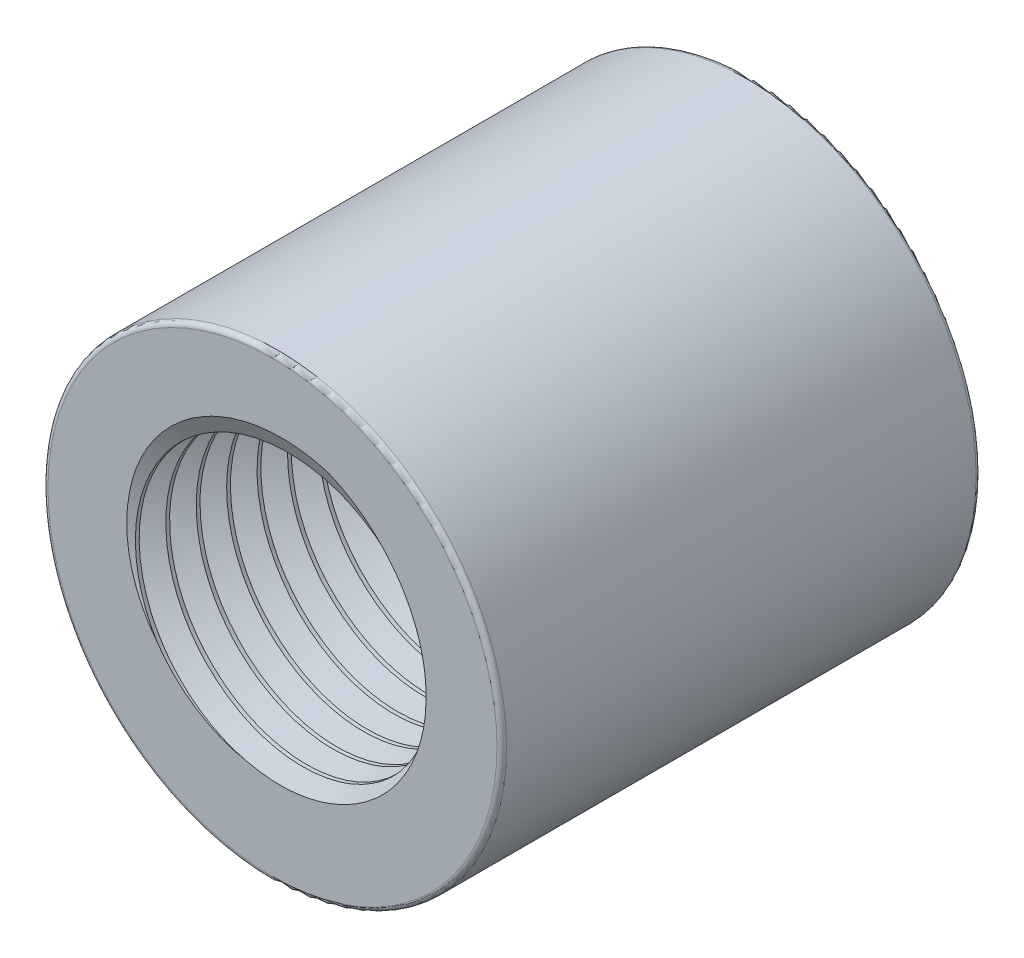
from build123d import *

# Parameters (mm, degrees)
SKETCH1_R           = 9.571872239
SKETCH1_R_2         = 5.842081884
BOSS_EXTRUDE1_DEPTH = 20
CUT_SWEEP2_PITCH    = 1.27
CUT_SWEEP3_PITCH    = 1.27
FILLET1_R           = 0.2


with BuildPart() as part:
    # Sketch1 → Boss-Extrude1 (new body)
    with BuildSketch(Plane.XY):
        with Locations((-0.518095238, -0.12952381)):
            Circle(SKETCH1_R)
        with Locations((-0.518095238, -0.12952381)):
            Circle(SKETCH1_R_2, mode=Mode.SUBTRACT)
    extrude(amount=BOSS_EXTRUDE1_DEPTH)

    # Cut-Sweep2: arcs per turn and ends read off the stored shape
    # Cut-Sweep2: the profile of Sketch3 screwed along a right-hand helix through 9 turns, 8 arcs to a turn; built about Z, then put on its axis
    cut_sweep2_z = Axis((0, 0, 0), (0, 0, 1))
    cut_sweep2_corners = [(5.477808504, -0.027220101, -0.483255868), (6.583610067, -0.006335529, -1.086883846), (5.507639332, 0.016335623, -1.742149438)]
    with BuildLine(mode=Mode.PRIVATE) as cut_sweep2_profile:
        Line(cut_sweep2_corners[0], cut_sweep2_corners[1])
        Line(cut_sweep2_corners[1], cut_sweep2_corners[2])
        Line(cut_sweep2_corners[2], cut_sweep2_corners[0])
    cut_sweep2_cap = Face(cut_sweep2_profile.wire())
    cut_sweep2_turn_angles = [0, 22.5, 45, 67.5, 90, 112.5, 135, 157.5, 180, 202.5, 225, 247.5, 270, 292.5, 315, 337.5, 360]
    cut_sweep2_turn_weights = [1, 0.9238795325112867, 1, 0.9238795325112867, 1, 0.9238795325112867, 1, 0.9238795325112867, 1, 0.9238795325112867, 1, 0.9238795325112867, 1, 0.9238795325112867, 1, 0.9238795325112867, 1]
    cut_sweep2_turn_rails = [Edge.make_bspline([Vector(p[0], p[1], 0).rotate(cut_sweep2_z, cut_sweep2_turn_angles[k]) / cut_sweep2_turn_weights[k] + Vector(0, 0, p[2] + CUT_SWEEP2_PITCH * cut_sweep2_turn_angles[k] / 360) for k in range(17)], [0, 0, 0, 1, 1, 2, 2, 3, 3, 4, 4, 5, 5, 6, 6, 7, 7, 8, 8, 8], 2, cut_sweep2_turn_weights) for p in cut_sweep2_corners]
    cut_sweep2_turn_sides = [Face.make_surface_from_curves(cut_sweep2_turn_rails[p[0]], cut_sweep2_turn_rails[p[1]]) for p in [(0, 1), (1, 2), (2, 0)]]
    cut_sweep2 = Plane(origin=(-0.518095238, -0.12952381, 0), x_dir=(0.7071067811865512, 0.7071067811865438, 0), z_dir=(0, 0, 1)) * Solid(Shell([*[p.moved(Location((0, 0, CUT_SWEEP2_PITCH * i))) for i in range(9) for p in cut_sweep2_turn_sides], cut_sweep2_cap, cut_sweep2_cap.rotate(cut_sweep2_z, 3240).moved(Location((0, 0, CUT_SWEEP2_PITCH * 3240 / 360)))]))
    add(cut_sweep2, mode=Mode.SUBTRACT)

    # Cut-Sweep3: arcs per turn and ends read off the stored shape
    # Cut-Sweep3: the profile of Sketch5 screwed along a right-hand helix through 9 turns, 8 arcs to a turn; built about Z, then put on its axis
    cut_sweep3_z = Axis((0, 0, 0), (0, 0, 1))
    cut_sweep3_corners = [(5.733766192, 0.03103443, -2.16698991), (5.690224279, -0.012507483, -0.908495491), (6.802535504, 0.007959602, -1.500056847)]
    with BuildLine(mode=Mode.PRIVATE) as cut_sweep3_profile:
        Line(cut_sweep3_corners[0], cut_sweep3_corners[1])
        Line(cut_sweep3_corners[1], cut_sweep3_corners[2])
        Line(cut_sweep3_corners[2], cut_sweep3_corners[0])
    cut_sweep3_cap = Face(cut_sweep3_profile.wire())
    cut_sweep3_turn_angles = [0, 22.5, 45, 67.5, 90, 112.5, 135, 157.5, 180, 202.5, 225, 247.5, 270, 292.5, 315, 337.5, 360]
    cut_sweep3_turn_weights = [1, 0.9238795325112867, 1, 0.9238795325112867, 1, 0.9238795325112867, 1, 0.9238795325112867, 1, 0.9238795325112867, 1, 0.9238795325112867, 1, 0.9238795325112867, 1, 0.9238795325112867, 1]
    cut_sweep3_turn_rails = [Edge.make_bspline([Vector(p[0], p[1], 0).rotate(cut_sweep3_z, cut_sweep3_turn_angles[k]) / cut_sweep3_turn_weights[k] + Vector(0, 0, p[2] + CUT_SWEEP3_PITCH * cut_sweep3_turn_angles[k] / 360) for k in range(17)], [0, 0, 0, 1, 1, 2, 2, 3, 3, 4, 4, 5, 5, 6, 6, 7, 7, 8, 8, 8], 2, cut_sweep3_turn_weights) for p in cut_sweep3_corners]
    cut_sweep3_turn_sides = [Face.make_surface_from_curves(cut_sweep3_turn_rails[p[0]], cut_sweep3_turn_rails[p[1]]) for p in [(0, 1), (1, 2), (2, 0)]]
    cut_sweep3 = Plane(origin=(-0.518095238, -0.12952381, 20), x_dir=(-0.7071067811865512, 0.7071067811865438, 0), z_dir=(0, 0, -1)) * Solid(Shell([*[p.moved(Location((0, 0, CUT_SWEEP3_PITCH * i))) for i in range(9) for p in cut_sweep3_turn_sides], cut_sweep3_cap, cut_sweep3_cap.rotate(cut_sweep3_z, 3240).moved(Location((0, 0, CUT_SWEEP3_PITCH * 3240 / 360)))]))
    add(cut_sweep3, mode=Mode.SUBTRACT)

    # Fillet1
    fillet1_edges = [part.edges().sort_by_distance(p)[0] for p in [
        (-10.089967477, -0.12952381, 0),
        (-10.089967477, -0.12952381, 20),
    ]]
    fillet(fillet1_edges, radius=FILLET1_R)


solid = part.part
